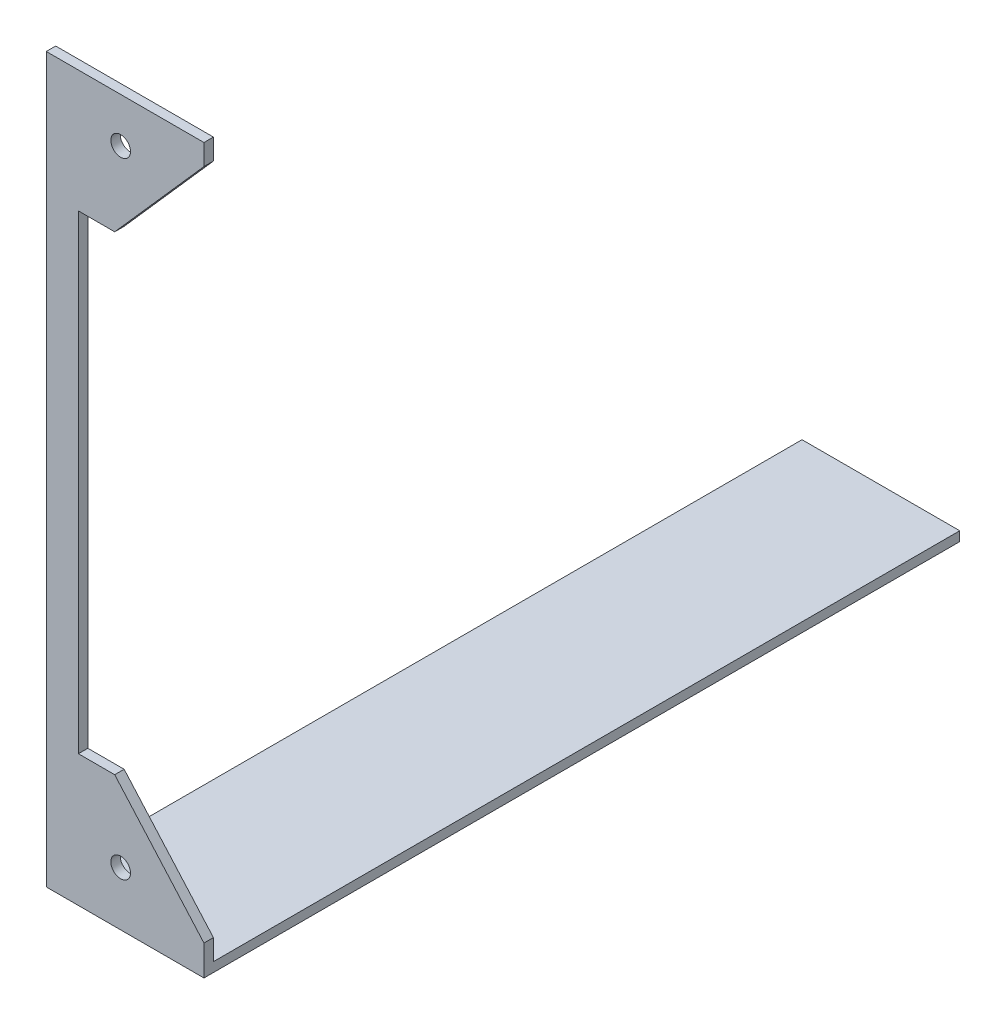
from build123d import *

# Parameters (mm, degrees)
BOSS_EXTRUDE1_DEPTH = 1.5875
SKETCH2_W           = 26.5
SKETCH2_H           = 127
BOSS_EXTRUDE2_DEPTH = 1.5875


with BuildPart() as part:
    # Sketch1 → Boss-Extrude1 (new body)
    with BuildSketch(Plane.XY):
        Polygon((-250, 120), (-223.5, 120), (-223.5, 116.5), (-238.5, 99.5), (-244.6, 99.5), (-244.6, 20.5), (-238.5, 20.5), (-223.5, 3.5), (-223.5, 0), (-250, 0), align=None)
        with BuildLine():
            ThreePointArc((-239.15, 112.5), (-237.5, 110.85), (-235.85, 112.5))
            ThreePointArc((-235.85, 112.5), (-237.5, 114.15), (-239.15, 112.5))
        make_face(mode=Mode.SUBTRACT)
        with BuildLine():
            ThreePointArc((-235.85, 7.5), (-237.5, 9.15), (-239.15, 7.5))
            ThreePointArc((-239.15, 7.5), (-237.5, 5.85), (-235.85, 7.5))
        make_face(mode=Mode.SUBTRACT)
    extrude(amount=BOSS_EXTRUDE1_DEPTH)

    # Sketch2 → Boss-Extrude2 (add)
    with BuildSketch(Plane(origin=(0, 0, 0), x_dir=(1, 0, 0), z_dir=(0, 1, 0))):
        with Locations((-236.75, 61.9125)):
            Rectangle(SKETCH2_W, SKETCH2_H)
    extrude(amount=-BOSS_EXTRUDE2_DEPTH)


solid = part.part
